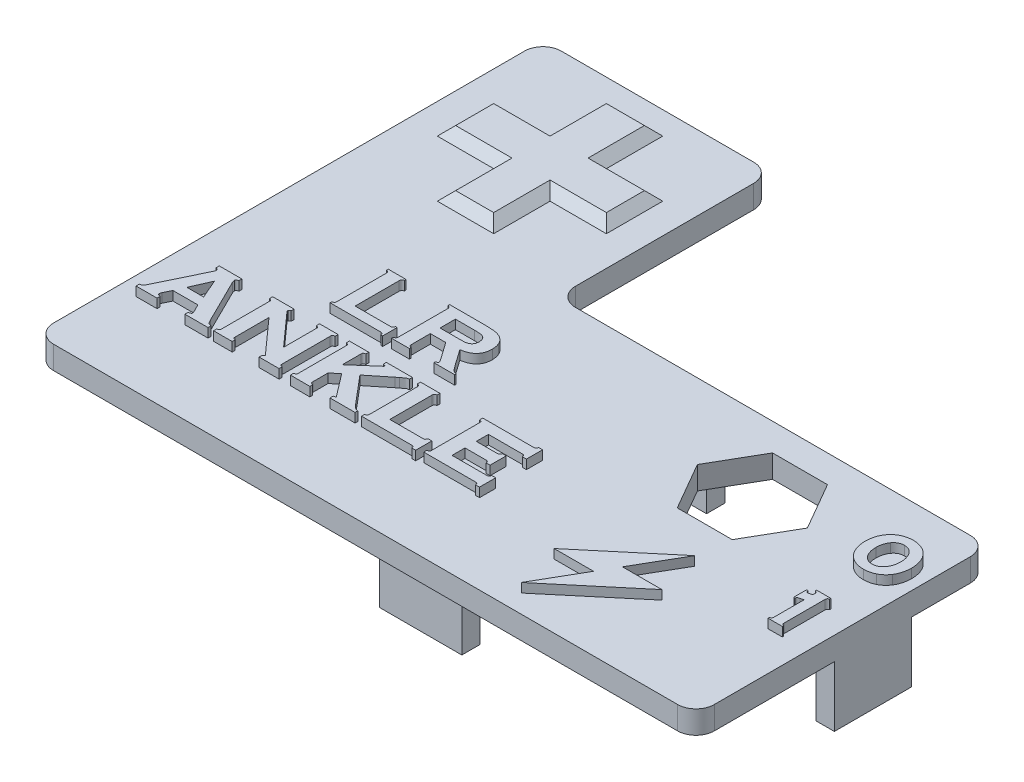
from build123d import *

# Parameters (mm, degrees)
BOSS_EXTRUDE1_DEPTH = 2.5
FILLET1_R           = 2
SKETCH2_W           = 2
SKETCH2_H           = 8.4
SKETCH2_W_2         = 9
SKETCH2_H_2         = 2
BOSS_EXTRUDE2_DEPTH = 6.6
BOSS_EXTRUDE3_DEPTH = 1
CUT_EXTRUDE1_DEPTH  = 2.5
CHAMFER1_SIZE       = 1


with BuildPart() as part:
    # Sketch1 → Boss-Extrude1 (new body)
    with BuildSketch(Plane(origin=(0, 0, 0), x_dir=(1, 0, 0), z_dir=(0, 1, 0))):
        Polygon((-36.05, 15.975), (-36.05, 39.425), (-11.05, 39.425), (-11.05, 15.975), (36.05, 15.975), (36.05, -15.975), (-36.05, -15.975), align=None)
    extrude(amount=BOSS_EXTRUDE1_DEPTH)

    # Fillet1
    fillet1_edges = [part.edges().sort_by_distance(p)[0] for p in [
        (36.05, 1.25, 15.975),
        (-36.05, 1.25, 15.975),
        (-36.05, 1.25, -39.425),
        (-11.05, 1.25, -39.425),
        (-11.05, 1.25, -15.975),
        (36.05, 1.25, -15.975),
    ]]
    fillet(fillet1_edges, radius=FILLET1_R)

    # Sketch2 → Boss-Extrude2 (add)
    with BuildSketch(Plane.XZ):
        with Locations((35.05, -3.325)):
            Rectangle(SKETCH2_W, SKETCH2_H)
        with Locations((4, -13.725)):
            Rectangle(SKETCH2_W_2, SKETCH2_H_2)
        with Locations((4, 12.975)):
            Rectangle(SKETCH2_W_2, SKETCH2_H_2)
    extrude(amount=BOSS_EXTRUDE2_DEPTH)

    # Sketch3 → Boss-Extrude3 (add)
    # profile 1 of 11: a face of its own
    with BuildSketch(Plane(origin=(0, 2.5, 0), x_dir=(1, 0, 0), z_dir=(0, 1, 0))):
        Polygon((21.914101615, -1.975), (19.027350269, -6.975), (23.328173533, -6.975), (14.985898385, -13.975), (17.872649731, -8.975), (13.571826467, -8.975), align=None)
    # profile 2 of 11: a face of its own
    with BuildSketch(Plane(origin=(0, 2.5, 0), x_dir=(1, 0, 0), z_dir=(0, 1, 0))):
        Polygon((-26.625, 36.925), (-20.475, 36.925), (-20.475, 30.775), (-14.325, 30.775), (-14.325, 24.625), (-20.475, 24.625), (-20.475, 18.475), (-26.625, 18.475), (-26.625, 24.625), (-32.775, 24.625), (-32.775, 30.775), (-26.625, 30.775), align=None)
    # profile 3 of 11: a face of its own
    with BuildSketch(Plane(origin=(0, 2.5, 0), x_dir=(1, 0, 0), z_dir=(0, 1, 0))):
        with BuildLine():
            Line((-28.887868924, -5.3875), (-31.609494358, -5.3875))
            Line((-31.609494358, -5.3875), (-32.007747396, -6.19640842))
            add(Edge.make_bspline(
                [(-32.007747396, -6.19640842), (-32.026988212, -6.238415936), (-32.062218579, -6.315332641), (-32.070248702, -6.39940725), (-32.073893229, -6.437565104)],
                knots=[0, 0, 0, 0, 1.092285905, 2, 2, 2, 2], degree=3))
            add(Edge.make_bspline(
                [(-32.073893229, -6.437565104), (-32.069750549, -6.461297047), (-32.060606622, -6.513679362), (-31.987706651, -6.572723084), (-31.887079831, -6.623630019), (-31.804132459, -6.645569845), (-31.756944444, -6.658051215)],
                knots=[0, 0, 0, 0, 0.683587642, 1.508848355, 2.58280622, 4, 4, 4, 4], degree=3))
            Line((-31.756944444, -6.658051215), (-31.756944444, -6.975))
            Line((-31.756944444, -6.975), (-34.05, -6.975))
            Line((-34.05, -6.975), (-34.05, -6.638758681))
            add(Edge.make_bspline(
                [(-34.05, -6.638758681), (-34.014901344, -6.631175306), (-33.949959524, -6.617144052), (-33.863351436, -6.58818868), (-33.793233504, -6.557797954), (-33.738628103, -6.516794774), (-33.692150597, -6.462690231), (-33.645903188, -6.390462401), (-33.5939489, -6.299111021), (-33.560783594, -6.229726186), (-33.542881944, -6.192274306)],
                knots=[0, 0, 0, 0, 1.200503865, 2.221250461, 3.05326795, 3.744957411, 4.485316885, 5.427465128, 6.611421828, 8, 8, 8, 8], degree=3))
            Line((-33.542881944, -6.192274306), (-31.244314236, -1.427018229))
            add(Edge.make_bspline(
                [(-31.244314236, -1.427018229), (-31.229133965, -1.394149346), (-31.200851032, -1.332910094), (-31.168619849, -1.245151715), (-31.149472106, -1.16873406), (-31.14550383, -1.121628495), (-31.143717448, -1.100423177)],
                knots=[0, 0, 0, 0, 1.262751781, 2.352680269, 3.258432874, 4, 4, 4, 4], degree=3))
            add(Edge.make_bspline(
                [(-31.143717448, -1.100423177), (-31.147149895, -1.076556341), (-31.154429213, -1.02594106), (-31.213053078, -0.962111092), (-31.296694535, -0.904783008), (-31.367407742, -0.879119553), (-31.406922743, -0.864778646)],
                knots=[0, 0, 0, 0, 0.756466092, 1.604265636, 2.661247999, 4, 4, 4, 4], degree=3))
            Line((-31.406922743, -0.864778646), (-31.406922743, -0.536805556))
            Line((-31.406922743, -0.536805556), (-28.937478299, -0.536805556))
            Line((-28.937478299, -0.536805556), (-28.937478299, -0.849620226))
            add(Edge.make_bspline(
                [(-28.937478299, -0.849620226), (-28.977753414, -0.862246921), (-29.04946042, -0.884727861), (-29.135969299, -0.935554829), (-29.197388427, -0.995538327), (-29.204298248, -1.045190935), (-29.207573785, -1.068728299)],
                knots=[0, 0, 0, 0, 1.358435652, 2.41859894, 3.25035135, 4, 4, 4, 4], degree=3))
            add(Edge.make_bspline(
                [(-29.207573785, -1.068728299), (-29.20641073, -1.092244153), (-29.203945602, -1.142086671), (-29.185686403, -1.218959979), (-29.15998342, -1.302952372), (-29.134333897, -1.358847418), (-29.120757378, -1.38843316)],
                knots=[0, 0, 0, 0, 0.845079754, 1.79117042, 2.830846991, 4, 4, 4, 4], degree=3))
            Line((-29.120757378, -1.38843316), (-26.786360677, -6.108213976))
            add(Edge.make_bspline(
                [(-26.786360677, -6.108213976), (-26.761621057, -6.158083937), (-26.716677153, -6.24868156), (-26.649233817, -6.36708325), (-26.593164942, -6.455717931), (-26.544599086, -6.522732768), (-26.481943514, -6.564589289), (-26.407048923, -6.600234161), (-26.310689309, -6.629511885), (-26.239412384, -6.644433549), (-26.200694444, -6.652539062)],
                knots=[0, 0, 0, 0, 1.572191128, 2.856163799, 3.842126326, 4.543098296, 5.165892684, 5.943351495, 6.882819452, 8, 8, 8, 8], degree=3))
            Line((-26.200694444, -6.652539062), (-26.200694444, -6.975))
            Line((-26.200694444, -6.975), (-28.714236111, -6.975))
            Line((-28.714236111, -6.975), (-28.714236111, -6.636002604))
            add(Edge.make_bspline(
                [(-28.714236111, -6.636002604), (-28.689800732, -6.63183729), (-28.643272432, -6.623905961), (-28.579191141, -6.606195814), (-28.524585473, -6.585670205), (-28.479871916, -6.56240819), (-28.444058301, -6.536197425), (-28.41826579, -6.505708511), (-28.40360988, -6.470425119), (-28.401251327, -6.445960473), (-28.400043403, -6.43343099)],
                knots=[0, 0, 0, 0, 1.46841687, 2.796066351, 3.933692653, 4.920221679, 5.775122949, 6.549019988, 7.256885662, 8, 8, 8, 8], degree=3))
            add(Edge.make_bspline(
                [(-28.400043403, -6.43343099), (-28.401504631, -6.41958108), (-28.404922257, -6.387187925), (-28.421381475, -6.333554115), (-28.448220593, -6.26839691), (-28.471358604, -6.221977603), (-28.484103733, -6.19640842)],
                knots=[0, 0, 0, 0, 0.659194425, 1.541770937, 2.645931803, 4, 4, 4, 4], degree=3))
            Line((-28.484103733, -6.19640842), (-28.887868924, -5.3875))
        make_face()
        Polygon((-29.321950955, -4.329166667), (-30.228700087, -2.238682726), (-31.146473524, -4.329166667), align=None, mode=Mode.SUBTRACT)
    # profile 4 of 11: a face of its own
    with BuildSketch(Plane(origin=(0, 2.5, 0), x_dir=(1, 0, 0), z_dir=(0, 1, 0))):
        with BuildLine():
            Line((-23.819444444, -2.697569444), (-23.819444444, -6.378309462))
            add(Edge.make_bspline(
                [(-23.819444444, -6.378309462), (-23.81874992, -6.399897216), (-23.817505954, -6.438563153), (-23.812851175, -6.491497032), (-23.802771835, -6.532130236), (-23.786380212, -6.565843949), (-23.75260927, -6.589008268), (-23.705314879, -6.613648804), (-23.636747132, -6.638793202), (-23.584313986, -6.655536385), (-23.554861111, -6.664941406)],
                knots=[0, 0, 0, 0, 1.168297272, 2.092543193, 2.863626271, 3.430493718, 4.06657787, 5.021996077, 6.327188346, 8, 8, 8, 8], degree=3))
            Line((-23.554861111, -6.664941406), (-23.554861111, -6.975))
            Line((-23.554861111, -6.975), (-25.583333333, -6.975))
            Line((-25.583333333, -6.975), (-25.583333333, -6.645648872))
            add(Edge.make_bspline(
                [(-25.583333333, -6.645648872), (-25.555278287, -6.636151539), (-25.504773644, -6.619054457), (-25.43778493, -6.594290002), (-25.389998947, -6.568424236), (-25.346617049, -6.534244531), (-25.322120961, -6.466247275), (-25.319983992, -6.41050045), (-25.31875, -6.378309462)],
                knots=[0, 0, 0, 0, 1.270903566, 2.287878308, 3.055159144, 3.600028367, 4.614137041, 6, 6, 6, 6], degree=3))
            Line((-25.31875, -6.378309462), (-25.31875, -1.127983941))
            add(Edge.make_bspline(
                [(-25.31875, -1.127983941), (-25.319913639, -1.09708089), (-25.32193507, -1.043397214), (-25.347399798, -0.97844533), (-25.389965355, -0.944749705), (-25.437798765, -0.918897567), (-25.504768663, -0.894127705), (-25.555276509, -0.877031544), (-25.583333333, -0.867534722)],
                knots=[0, 0, 0, 0, 1.348336138, 2.342281394, 2.895882114, 3.675458579, 4.708730281, 6, 6, 6, 6], degree=3))
            Line((-25.583333333, -0.867534722), (-25.583333333, -0.536805556))
            Line((-25.583333333, -0.536805556), (-23.248936632, -0.536805556))
            Line((-23.248936632, -0.536805556), (-23.248936632, -0.852376302))
            add(Edge.make_bspline(
                [(-23.248936632, -0.852376302), (-23.277276585, -0.861127625), (-23.327847224, -0.876743742), (-23.392380515, -0.90956379), (-23.433489822, -0.956210264), (-23.439170929, -0.992352602), (-23.441861979, -1.009472656)],
                knots=[0, 0, 0, 0, 1.333897094, 2.380244923, 3.232747595, 4, 4, 4, 4], degree=3))
            add(Edge.make_bspline(
                [(-23.441861979, -1.009472656), (-23.438353198, -1.042843704), (-23.431231825, -1.11057311), (-23.388000592, -1.163265439), (-23.366069878, -1.18999566)],
                knots=[0, 0, 0, 0, 0.985422698, 2, 2, 2, 2], degree=3))
            Line((-23.366069878, -1.18999566), (-20.203472222, -4.719151476))
            Line((-20.203472222, -4.719151476), (-20.203472222, -1.127983941))
            add(Edge.make_bspline(
                [(-20.203472222, -1.127983941), (-20.204635861, -1.09708089), (-20.206657292, -1.043397214), (-20.23212202, -0.97844533), (-20.274687577, -0.944749705), (-20.322520988, -0.918897567), (-20.389490885, -0.894127705), (-20.439998731, -0.877031544), (-20.468055556, -0.867534722)],
                knots=[0, 0, 0, 0, 1.348336138, 2.342281394, 2.895882114, 3.675458579, 4.708730281, 6, 6, 6, 6], degree=3))
            Line((-20.468055556, -0.867534722), (-20.468055556, -0.536805556))
            Line((-20.468055556, -0.536805556), (-18.439583333, -0.536805556))
            Line((-18.439583333, -0.536805556), (-18.439583333, -0.848242187))
            add(Edge.make_bspline(
                [(-18.439583333, -0.848242187), (-18.468603571, -0.857626663), (-18.520590241, -0.874437952), (-18.588732689, -0.900165223), (-18.637666064, -0.923510568), (-18.670768273, -0.948727557), (-18.687039353, -0.981558828), (-18.697866709, -1.020687503), (-18.702060164, -1.070960242), (-18.703420307, -1.107779735), (-18.704166667, -1.127983941)],
                knots=[0, 0, 0, 0, 1.677063113, 3.004280154, 3.998210204, 4.661097541, 5.237530725, 5.972938197, 6.887676847, 8, 8, 8, 8], degree=3))
            Line((-18.704166667, -1.127983941), (-18.704166667, -6.378309462))
            add(Edge.make_bspline(
                [(-18.704166667, -6.378309462), (-18.703472142, -6.399897216), (-18.702228176, -6.438563153), (-18.697573397, -6.491497032), (-18.687494058, -6.532130236), (-18.671102434, -6.565843949), (-18.637331492, -6.589008268), (-18.590037101, -6.613648804), (-18.521469354, -6.638793202), (-18.469036208, -6.655536385), (-18.439583333, -6.664941406)],
                knots=[0, 0, 0, 0, 1.168297272, 2.092543193, 2.863626271, 3.430493718, 4.06657787, 5.021996077, 6.327188346, 8, 8, 8, 8], degree=3))
            Line((-18.439583333, -6.664941406), (-18.439583333, -6.975))
            Line((-18.439583333, -6.975), (-20.621017795, -6.975))
            Line((-20.621017795, -6.975), (-20.621017795, -6.640136719))
            add(Edge.make_bspline(
                [(-20.621017795, -6.640136719), (-20.592952497, -6.633446707), (-20.543754498, -6.621719228), (-20.484789177, -6.592542598), (-20.440593323, -6.559640341), (-20.435804948, -6.528873277), (-20.433604601, -6.514735243)],
                knots=[0, 0, 0, 0, 1.427158009, 2.501784109, 3.311542117, 4, 4, 4, 4], degree=3))
            add(Edge.make_bspline(
                [(-20.433604601, -6.514735243), (-20.437214279, -6.502543418), (-20.446973398, -6.469581625), (-20.488103016, -6.416367421), (-20.549742152, -6.344175674), (-20.600482948, -6.290351523), (-20.629286024, -6.259798177)],
                knots=[0, 0, 0, 0, 0.467922828, 1.265075161, 2.447516532, 4, 4, 4, 4], degree=3))
            Line((-20.629286024, -6.259798177), (-23.819444444, -2.697569444))
        make_face()
    # profile 5 of 11: a face of its own
    with BuildSketch(Plane(origin=(0, 2.5, 0), x_dir=(1, 0, 0), z_dir=(0, 1, 0))):
        with BuildLine():
            Line((-14.556271701, -4.027376302), (-15.352777778, -4.731553819))
            Line((-15.352777778, -4.731553819), (-15.352777778, -6.378309462))
            add(Edge.make_bspline(
                [(-15.352777778, -6.378309462), (-15.352294698, -6.399472319), (-15.351419891, -6.437795987), (-15.344337958, -6.489945623), (-15.334897246, -6.531568086), (-15.316828072, -6.565285209), (-15.283642964, -6.59109629), (-15.235136496, -6.614285804), (-15.167755067, -6.638583322), (-15.116742415, -6.654600019), (-15.088194444, -6.663563368)],
                knots=[0, 0, 0, 0, 1.148820936, 2.080391588, 2.85507263, 3.458551883, 4.113480583, 5.09547749, 6.374555674, 8, 8, 8, 8], degree=3))
            Line((-15.088194444, -6.663563368), (-15.088194444, -6.975))
            Line((-15.088194444, -6.975), (-17.204861111, -6.975))
            Line((-17.204861111, -6.975), (-17.204861111, -6.645648872))
            add(Edge.make_bspline(
                [(-17.204861111, -6.645648872), (-17.176806065, -6.636151539), (-17.126301421, -6.619054457), (-17.059312708, -6.594290002), (-17.011526725, -6.568424236), (-16.968144827, -6.534244531), (-16.943648739, -6.466247275), (-16.94151177, -6.41050045), (-16.940277778, -6.378309462)],
                knots=[0, 0, 0, 0, 1.270903566, 2.287878308, 3.055159144, 3.600028367, 4.614137041, 6, 6, 6, 6], degree=3))
            Line((-16.940277778, -6.378309462), (-16.940277778, -1.127983941))
            add(Edge.make_bspline(
                [(-16.940277778, -1.127983941), (-16.941441416, -1.09708089), (-16.943462848, -1.043397214), (-16.968927576, -0.97844533), (-17.011493132, -0.944749705), (-17.059326543, -0.918897567), (-17.126296441, -0.894127705), (-17.176804286, -0.877031544), (-17.204861111, -0.867534722)],
                knots=[0, 0, 0, 0, 1.348336138, 2.342281394, 2.895882114, 3.675458579, 4.708730281, 6, 6, 6, 6], degree=3))
            Line((-17.204861111, -0.867534722), (-17.204861111, -0.536805556))
            Line((-17.204861111, -0.536805556), (-15.088194444, -0.536805556))
            Line((-15.088194444, -0.536805556), (-15.088194444, -0.850998264))
            add(Edge.make_bspline(
                [(-15.088194444, -0.850998264), (-15.117284725, -0.859263131), (-15.169037966, -0.873966793), (-15.236076366, -0.899411349), (-15.285198453, -0.92063671), (-15.317957012, -0.946020118), (-15.334356557, -0.978778043), (-15.344578685, -1.017604085), (-15.351243332, -1.066223073), (-15.35223764, -1.101778809), (-15.352777778, -1.12109375)],
                knots=[0, 0, 0, 0, 1.689553727, 3.005810864, 4.004869542, 4.678835048, 5.264901578, 6.012599175, 6.920384306, 8, 8, 8, 8], degree=3))
            Line((-15.352777778, -1.12109375), (-15.352777778, -3.15921224))
            Line((-15.352777778, -3.15921224), (-13.055588108, -1.147276476))
            add(Edge.make_bspline(
                [(-13.055588108, -1.147276476), (-13.033740425, -1.129143656), (-12.995119847, -1.097089912), (-12.947773384, -1.052208786), (-12.916983038, -1.016007235), (-12.909553614, -0.992230514), (-12.906759983, -0.983289931)],
                knots=[0, 0, 0, 0, 1.515017203, 2.678125759, 3.502945504, 4, 4, 4, 4], degree=3))
            add(Edge.make_bspline(
                [(-12.906759983, -0.983289931), (-12.911472655, -0.972871707), (-12.924209537, -0.944714503), (-12.984178706, -0.922434641), (-13.065743577, -0.894133596), (-13.134536877, -0.881620882), (-13.174099392, -0.874424913)],
                knots=[0, 0, 0, 0, 0.446973481, 1.208029717, 2.394358675, 4, 4, 4, 4], degree=3))
            Line((-13.174099392, -0.874424913), (-13.174099392, -0.536805556))
            Line((-13.174099392, -0.536805556), (-10.325694444, -0.536805556))
            Line((-10.325694444, -0.536805556), (-10.325694444, -0.859266493))
            add(Edge.make_bspline(
                [(-10.325694444, -0.859266493), (-10.362887585, -0.867039679), (-10.428205845, -0.880690878), (-10.514311055, -0.899085661), (-10.573154464, -0.916834955), (-10.611015306, -0.929405829), (-10.633232593, -0.94737057), (-10.659230067, -0.965117026), (-10.694171619, -0.992852381), (-10.739738786, -1.028538429), (-10.794825843, -1.072692799), (-10.859704008, -1.125487776), (-10.935432465, -1.185630628), (-10.98902703, -1.228994311), (-11.017469618, -1.252007378)],
                knots=[0, 0, 0, 0, 1.684495241, 2.95829537, 3.892088238, 4.42126145, 4.698089674, 5.149995523, 5.817617521, 6.672678047, 7.715250913, 8.945376179, 10.378913871, 12, 12, 12, 12], degree=3))
            Line((-11.017469618, -1.252007378), (-11.302723524, -1.46422526))
            Line((-11.302723524, -1.46422526), (-13.420768229, -3.172992622))
            Line((-13.420768229, -3.172992622), (-11.047786458, -5.986946615))
            add(Edge.make_bspline(
                [(-11.047786458, -5.986946615), (-11.019321086, -6.021868095), (-10.965289867, -6.088153903), (-10.888188133, -6.182305046), (-10.817950173, -6.265043392), (-10.754396908, -6.337048307), (-10.697652943, -6.398402958), (-10.650620892, -6.451477179), (-10.608387901, -6.491542629), (-10.561531984, -6.53433952), (-10.494583075, -6.575932546), (-10.398531494, -6.615313875), (-10.28161712, -6.649291216), (-10.195426483, -6.664872196), (-10.149305556, -6.673209635)],
                knots=[0, 0, 0, 0, 1.3856826, 2.630217524, 3.742735644, 4.723579208, 5.583639575, 6.31351798, 6.903006854, 7.373487758, 8.263094004, 9.3075047, 10.559235838, 12, 12, 12, 12], degree=3))
            Line((-10.149305556, -6.673209635), (-10.149305556, -6.975))
            Line((-10.149305556, -6.975), (-12.888845486, -6.975))
            Line((-12.888845486, -6.975), (-12.888845486, -6.638758681))
            add(Edge.make_bspline(
                [(-12.888845486, -6.638758681), (-12.852634475, -6.631181887), (-12.789815144, -6.618037568), (-12.713793682, -6.593213057), (-12.659250891, -6.572288109), (-12.646615732, -6.547034268), (-12.642176649, -6.538161892)],
                knots=[0, 0, 0, 0, 1.609728793, 2.792578347, 3.575799217, 4, 4, 4, 4], degree=3))
            add(Edge.make_bspline(
                [(-12.642176649, -6.538161892), (-12.6460239, -6.528360921), (-12.658231487, -6.49726178), (-12.701274723, -6.442765021), (-12.764868287, -6.358573837), (-12.817361435, -6.294077528), (-12.84750434, -6.257042101)],
                knots=[0, 0, 0, 0, 0.360711672, 1.144562472, 2.360334903, 4, 4, 4, 4], degree=3))
            Line((-12.84750434, -6.257042101), (-14.556271701, -4.027376302))
        make_face()
    # profile 6 of 11: a face of its own
    with BuildSketch(Plane(origin=(0, 2.5, 0), x_dir=(1, 0, 0), z_dir=(0, 1, 0))):
        with BuildLine():
            Line((-7.591666667, -5.740277778), (-3.955023872, -5.740277778))
            add(Edge.make_bspline(
                [(-3.955023872, -5.740277778), (-3.923196297, -5.739194859), (-3.8675538, -5.737301649), (-3.800712629, -5.710963009), (-3.766204678, -5.66773318), (-3.740695581, -5.619549405), (-3.713832577, -5.553868246), (-3.697839392, -5.503394118), (-3.6890625, -5.475694444)],
                knots=[0, 0, 0, 0, 1.37289143, 2.400154871, 2.947667793, 3.718671465, 4.748030781, 6, 6, 6, 6], degree=3))
            Line((-3.6890625, -5.475694444), (-3.270138889, -5.475694444))
            Line((-3.270138889, -5.475694444), (-3.270138889, -7.239583333))
            Line((-3.270138889, -7.239583333), (-3.6890625, -7.239583333))
            add(Edge.make_bspline(
                [(-3.6890625, -7.239583333), (-3.698477309, -7.211491916), (-3.715290333, -7.161326086), (-3.740750423, -7.095113519), (-3.766234907, -7.04754136), (-3.800452979, -7.004699227), (-3.865567596, -6.977983941), (-3.919941481, -6.976082343), (-3.950889757, -6.975)],
                knots=[0, 0, 0, 0, 1.289536581, 2.302862591, 3.081392711, 3.63425039, 4.653473594, 6, 6, 6, 6], degree=3))
            Line((-3.950889757, -6.975), (-9.44375, -6.975))
            Line((-9.44375, -6.975), (-9.44375, -6.645648872))
            add(Edge.make_bspline(
                [(-9.44375, -6.645648872), (-9.415694954, -6.636151539), (-9.36519031, -6.619054457), (-9.298201597, -6.594290002), (-9.250415614, -6.568424236), (-9.207033716, -6.534244531), (-9.182537628, -6.466247275), (-9.180400659, -6.41050045), (-9.179166667, -6.378309462)],
                knots=[0, 0, 0, 0, 1.270903566, 2.287878308, 3.055159144, 3.600028367, 4.614137041, 6, 6, 6, 6], degree=3))
            Line((-9.179166667, -6.378309462), (-9.179166667, -1.133496094))
            add(Edge.make_bspline(
                [(-9.179166667, -1.133496094), (-9.180282314, -1.101255409), (-9.182199886, -1.045840197), (-9.20742284, -0.978690716), (-9.250399822, -0.944754866), (-9.298208101, -0.918895441), (-9.365187969, -0.894128471), (-9.415694118, -0.877031817), (-9.44375, -0.867534722)],
                knots=[0, 0, 0, 0, 1.390022291, 2.38916702, 2.935671537, 3.705255179, 4.725282125, 6, 6, 6, 6], degree=3))
            Line((-9.44375, -0.867534722), (-9.44375, -0.536805556))
            Line((-9.44375, -0.536805556), (-7.327083333, -0.536805556))
            Line((-7.327083333, -0.536805556), (-7.327083333, -0.850998264))
            add(Edge.make_bspline(
                [(-7.327083333, -0.850998264), (-7.35620903, -0.859139979), (-7.40818445, -0.873669042), (-7.475196328, -0.900540733), (-7.523727106, -0.923517155), (-7.557383821, -0.948897803), (-7.572825581, -0.982691482), (-7.583887338, -1.022546014), (-7.590061106, -1.073619752), (-7.591099106, -1.111439075), (-7.591666667, -1.132118056)],
                knots=[0, 0, 0, 0, 1.654165102, 2.951892616, 3.941266893, 4.601115824, 5.197056547, 5.929093209, 6.867662398, 8, 8, 8, 8], degree=3))
            Line((-7.591666667, -1.132118056), (-7.591666667, -5.740277778))
        make_face()
    # profile 7 of 11: a face of its own
    with BuildSketch(Plane(origin=(0, 2.5, 0), x_dir=(1, 0, 0), z_dir=(0, 1, 0))):
        with BuildLine():
            Line((-0.800694444, -4.329166667), (-0.800694444, -5.740277778))
            Line((-0.800694444, -5.740277778), (3.016471354, -5.740277778))
            add(Edge.make_bspline(
                [(3.016471354, -5.740277778), (3.047422122, -5.739196439), (3.101800384, -5.737296604), (3.166891936, -5.710572029), (3.201162155, -5.667750897), (3.226663153, -5.619542044), (3.253529365, -5.553870821), (3.269522013, -5.50339503), (3.278298611, -5.475694444)],
                knots=[0, 0, 0, 0, 1.34636125, 2.365459444, 2.918249314, 3.696683944, 4.73596426, 6, 6, 6, 6], degree=3))
            Line((3.278298611, -5.475694444), (3.697222222, -5.475694444))
            Line((3.697222222, -5.475694444), (3.697222222, -7.239583333))
            Line((3.697222222, -7.239583333), (3.278298611, -7.239583333))
            add(Edge.make_bspline(
                [(3.278298611, -7.239583333), (3.26881837, -7.211528728), (3.251888496, -7.161428635), (3.227029737, -7.094617869), (3.19964743, -7.047847345), (3.165880196, -7.005029981), (3.10280327, -6.978204932), (3.050194149, -6.976153677), (3.020605469, -6.975)],
                knots=[0, 0, 0, 0, 1.304247938, 2.329134225, 3.126603422, 3.68576824, 4.698418437, 6, 6, 6, 6], degree=3))
            Line((3.020605469, -6.975), (-2.652777778, -6.975))
            Line((-2.652777778, -6.975), (-2.652777778, -6.645648872))
            add(Edge.make_bspline(
                [(-2.652777778, -6.645648872), (-2.624722732, -6.636151539), (-2.574218088, -6.619054457), (-2.507229375, -6.594290002), (-2.459443391, -6.568424236), (-2.416061494, -6.534244531), (-2.391565406, -6.466247275), (-2.389428437, -6.41050045), (-2.388194444, -6.378309462)],
                knots=[0, 0, 0, 0, 1.270903566, 2.287878308, 3.055159144, 3.600028367, 4.614137041, 6, 6, 6, 6], degree=3))
            Line((-2.388194444, -6.378309462), (-2.388194444, -1.133496094))
            add(Edge.make_bspline(
                [(-2.388194444, -1.133496094), (-2.389310092, -1.101255409), (-2.391227664, -1.045840197), (-2.416450618, -0.978690716), (-2.4594276, -0.944754866), (-2.507235878, -0.918895441), (-2.574215747, -0.894128471), (-2.624721895, -0.877031817), (-2.652777778, -0.867534722)],
                knots=[0, 0, 0, 0, 1.390022291, 2.38916702, 2.935671537, 3.705255179, 4.725282125, 6, 6, 6, 6], degree=3))
            Line((-2.652777778, -0.867534722), (-2.652777778, -0.536805556))
            Line((-2.652777778, -0.536805556), (2.931032986, -0.536805556))
            add(Edge.make_bspline(
                [(2.931032986, -0.536805556), (2.961085458, -0.53571096), (3.014163652, -0.533777704), (3.077694466, -0.50678001), (3.111433219, -0.46395028), (3.139178521, -0.416868232), (3.163095629, -0.349691075), (3.180499731, -0.299770719), (3.190104167, -0.272222222)],
                knots=[0, 0, 0, 0, 1.317339458, 2.326663858, 2.883992238, 3.678842347, 4.719071565, 6, 6, 6, 6], degree=3))
            Line((3.190104167, -0.272222222), (3.609027778, -0.272222222))
            Line((3.609027778, -0.272222222), (3.609027778, -2.036111111))
            Line((3.609027778, -2.036111111), (3.190104167, -2.036111111))
            add(Edge.make_bspline(
                [(3.190104167, -2.036111111), (3.181428424, -2.00835834), (3.16574598, -1.958191877), (3.13800279, -1.893457716), (3.113213919, -1.844806679), (3.076562329, -1.802911028), (3.012255323, -1.774295539), (2.957510193, -1.772520378), (2.926898872, -1.771527778)],
                knots=[0, 0, 0, 0, 1.263696698, 2.284283375, 3.062509213, 3.628357544, 4.673870881, 6, 6, 6, 6], degree=3))
            Line((2.926898872, -1.771527778), (-0.800694444, -1.771527778))
            Line((-0.800694444, -1.771527778), (-0.800694444, -3.094444444))
            Line((-0.800694444, -3.094444444), (1.519921875, -3.094444444))
            add(Edge.make_bspline(
                [(1.519921875, -3.094444444), (1.550835007, -3.093286079), (1.604536195, -3.091273808), (1.669396894, -3.065761382), (1.703557034, -3.022985336), (1.728194554, -2.974541889), (1.754455785, -2.908395749), (1.770197407, -2.858012697), (1.778993056, -2.829861111)],
                knots=[0, 0, 0, 0, 1.350007337, 2.345184541, 2.899471423, 3.697568048, 4.713513627, 6, 6, 6, 6], degree=3))
            Line((1.778993056, -2.829861111), (2.197916667, -2.829861111))
            Line((2.197916667, -2.829861111), (2.197916667, -4.59375))
            Line((2.197916667, -4.59375), (1.778993056, -4.59375))
            add(Edge.make_bspline(
                [(1.778993056, -4.59375), (1.769423972, -4.566642156), (1.752108787, -4.517590719), (1.727744258, -4.451549956), (1.700368081, -4.404719593), (1.666342048, -4.361965651), (1.603439721, -4.333328245), (1.55005454, -4.330668136), (1.519921875, -4.329166667)],
                knots=[0, 0, 0, 0, 1.26750182, 2.293534889, 3.091896403, 3.651686891, 4.674521096, 6, 6, 6, 6], degree=3))
            Line((1.519921875, -4.329166667), (-0.800694444, -4.329166667))
        make_face()
    # profile 8 of 11: a face of its own
    with BuildSketch(Plane(origin=(0, 2.5, 0), x_dir=(1, 0, 0), z_dir=(0, 1, 0))):
        with BuildLine():
            Line((-20.194791667, 3.083333333), (-16.381759983, 3.083333333))
            add(Edge.make_bspline(
                [(-16.381759983, 3.083333333), (-16.359669473, 3.08415726), (-16.317940569, 3.085713654), (-16.259695093, 3.096279186), (-16.209945218, 3.114668035), (-16.166613255, 3.139486458), (-16.130762423, 3.176744953), (-16.099829999, 3.223685494), (-16.071795056, 3.281692258), (-16.057399092, 3.324748542), (-16.049652778, 3.347916667)],
                knots=[0, 0, 0, 0, 1.13718709, 2.148142964, 3.030969728, 3.85821599, 4.694202194, 5.66481062, 6.743459618, 8, 8, 8, 8], degree=3))
            Line((-16.049652778, 3.347916667), (-15.873263889, 3.347916667))
            Line((-15.873263889, 3.347916667), (-15.873263889, 1.760416667))
            Line((-15.873263889, 1.760416667), (-16.049652778, 1.760416667))
            add(Edge.make_bspline(
                [(-16.049652778, 1.760416667), (-16.05751257, 1.783522919), (-16.072252661, 1.826855906), (-16.098990934, 1.885620961), (-16.131257353, 1.931681921), (-16.166513714, 1.969016056), (-16.210280722, 1.993225085), (-16.259600252, 2.014506541), (-16.319116666, 2.021822153), (-16.361106198, 2.0239064), (-16.383138021, 2.025)],
                knots=[0, 0, 0, 0, 1.251925329, 2.347834872, 3.295457317, 4.12837309, 4.952581021, 5.840642677, 6.866989599, 8, 8, 8, 8], degree=3))
            Line((-16.383138021, 2.025), (-21.870486111, 2.025))
            Line((-21.870486111, 2.025), (-21.870486111, 2.201388889))
            add(Edge.make_bspline(
                [(-21.870486111, 2.201388889), (-21.84737908, 2.209248385), (-21.804044632, 2.223987922), (-21.745289064, 2.250729794), (-21.699198827, 2.282985108), (-21.661957986, 2.318276858), (-21.636981363, 2.362666226), (-21.617173449, 2.412988597), (-21.608749169, 2.473072668), (-21.606895471, 2.51511544), (-21.605902778, 2.537630208)],
                knots=[0, 0, 0, 0, 1.245049627, 2.334940322, 3.277358327, 4.105699642, 4.925380938, 5.852235277, 6.849827876, 8, 8, 8, 8], degree=3))
            Line((-21.605902778, 2.537630208), (-21.605902778, 7.862369792))
            add(Edge.make_bspline(
                [(-21.605902778, 7.862369792), (-21.606915907, 7.884878495), (-21.608807765, 7.926909942), (-21.616922496, 7.986640616), (-21.637244869, 8.03635842), (-21.66234903, 8.080392165), (-21.698667664, 8.117087354), (-21.745374463, 8.14918498), (-21.804018234, 8.176038422), (-21.847369899, 8.190760777), (-21.870486111, 8.198611111)],
                knots=[0, 0, 0, 0, 1.150912396, 2.149147064, 3.054708998, 3.874917856, 4.720532304, 5.663556867, 6.754149036, 8, 8, 8, 8], degree=3))
            Line((-21.870486111, 8.198611111), (-21.870486111, 8.375))
            Line((-21.870486111, 8.375), (-19.930208333, 8.375))
            Line((-19.930208333, 8.375), (-19.930208333, 8.198611111))
            add(Edge.make_bspline(
                [(-19.930208333, 8.198611111), (-19.95332054, 8.191247244), (-19.996209045, 8.177582375), (-20.05517834, 8.151564947), (-20.101451545, 8.118754642), (-20.138718662, 8.081592477), (-20.163451889, 8.03687586), (-20.181829327, 7.98577935), (-20.19240531, 7.926178987), (-20.193966206, 7.883540547), (-20.194791667, 7.860991753)],
                knots=[0, 0, 0, 0, 1.233044476, 2.288117098, 3.259808654, 4.10196579, 4.938928384, 5.832590396, 6.853793133, 8, 8, 8, 8], degree=3))
            Line((-20.194791667, 7.860991753), (-20.194791667, 3.083333333))
        make_face()
    # profile 9 of 11: a face of its own
    with BuildSketch(Plane(origin=(0, 2.5, 0), x_dir=(1, 0, 0), z_dir=(0, 1, 0))):
        with BuildLine():
            Line((-13.492013889, 4.582638889), (-13.492013889, 2.527983941))
            add(Edge.make_bspline(
                [(-13.492013889, 2.527983941), (-13.491216918, 2.506342162), (-13.489713044, 2.46550442), (-13.47876255, 2.408306229), (-13.460907961, 2.358547365), (-13.434365104, 2.315422257), (-13.396056206, 2.280677062), (-13.350508551, 2.248088055), (-13.292402129, 2.222700887), (-13.250058737, 2.208811393), (-13.227430556, 2.201388889)],
                knots=[0, 0, 0, 0, 1.124460146, 2.121840966, 3.013286232, 3.861139776, 4.722335659, 5.682736552, 6.761661326, 8, 8, 8, 8], degree=3))
            Line((-13.227430556, 2.201388889), (-13.227430556, 2.025))
            Line((-13.227430556, 2.025), (-15.167708333, 2.025))
            Line((-15.167708333, 2.025), (-15.167708333, 2.201388889))
            add(Edge.make_bspline(
                [(-15.167708333, 2.201388889), (-15.144601639, 2.209248522), (-15.101267823, 2.223988314), (-15.042508153, 2.250728526), (-14.996430573, 2.282988964), (-14.959149401, 2.318264384), (-14.934534954, 2.362337372), (-14.914335353, 2.411541713), (-14.905979199, 2.470319155), (-14.904121286, 2.511443566), (-14.903125, 2.533496094)],
                knots=[0, 0, 0, 0, 1.255780561, 2.355064893, 3.305605487, 4.141086176, 4.967832208, 5.880611589, 6.863500559, 8, 8, 8, 8], degree=3))
            Line((-14.903125, 2.533496094), (-14.903125, 7.862369792))
            add(Edge.make_bspline(
                [(-14.903125, 7.862369792), (-14.904138129, 7.884878495), (-14.906029987, 7.926909942), (-14.914144718, 7.986640616), (-14.934467091, 8.03635842), (-14.959571252, 8.080392165), (-14.995889886, 8.117087354), (-15.042596685, 8.14918498), (-15.101240456, 8.176038422), (-15.144592122, 8.190760777), (-15.167708333, 8.198611111)],
                knots=[0, 0, 0, 0, 1.150912396, 2.149147064, 3.054708998, 3.874917856, 4.720532304, 5.663556867, 6.754149036, 8, 8, 8, 8], degree=3))
            Line((-15.167708333, 8.198611111), (-15.167708333, 8.375))
            Line((-15.167708333, 8.375), (-11.23203125, 8.375))
            add(Edge.make_bspline(
                [(-11.23203125, 8.375), (-11.118095899, 8.37394185), (-10.902975765, 8.371943968), (-10.598579471, 8.357312062), (-10.331644526, 8.332343595), (-10.097596914, 8.295250246), (-9.888734521, 8.244849599), (-9.69674322, 8.180844138), (-9.518372225, 8.099345565), (-9.409176957, 8.032080657), (-9.355143229, 7.998795573)],
                knots=[0, 0, 0, 0, 1.407806318, 2.658064248, 3.764457201, 4.719038315, 5.583565669, 6.416396437, 7.216376255, 8, 8, 8, 8], degree=3))
            add(Edge.make_bspline(
                [(-9.355143229, 7.998795573), (-9.29674757, 7.956392494), (-9.180940499, 7.87230103), (-9.032606466, 7.71612757), (-8.906249233, 7.540142276), (-8.843811781, 7.409168697), (-8.812196181, 7.342849392)],
                knots=[0, 0, 0, 0, 1.001529461, 1.98617835, 2.980288594, 4, 4, 4, 4], degree=3))
            add(Edge.make_bspline(
                [(-8.812196181, 7.342849392), (-8.785914331, 7.275815443), (-8.733134514, 7.141196319), (-8.680614378, 6.929738528), (-8.647694021, 6.711370865), (-8.643464105, 6.56345986), (-8.641319444, 6.488465712)],
                knots=[0, 0, 0, 0, 0.984363557, 1.976821606, 2.974203853, 4, 4, 4, 4], degree=3))
            add(Edge.make_bspline(
                [(-8.641319444, 6.488465712), (-8.64253718, 6.425468581), (-8.644917323, 6.30233657), (-8.666560604, 6.122739113), (-8.698593487, 5.952792968), (-8.745798949, 5.793110306), (-8.806476043, 5.643404224), (-8.881036513, 5.504028837), (-8.968516489, 5.374484989), (-9.06980986, 5.255361151), (-9.184938402, 5.146048408), (-9.313310168, 5.046826682), (-9.45552805, 4.957903244), (-9.611089861, 4.879762369), (-9.780130717, 4.812578125), (-9.961946861, 4.754422431), (-10.157230339, 4.706366704), (-10.292964279, 4.682869129), (-10.362489149, 4.670833333)],
                knots=[0, 0, 0, 0, 1.087205603, 2.125014432, 3.118864887, 4.069900136, 4.994750613, 5.903029732, 6.793864856, 7.688469125, 8.597198221, 9.529937486, 10.484899445, 11.48860474, 12.531250455, 13.622238558, 14.782076498, 16, 16, 16, 16], degree=3))
            Line((-10.362489149, 4.670833333), (-9.13327908, 2.922102865))
            add(Edge.make_bspline(
                [(-9.13327908, 2.922102865), (-9.107268167, 2.886145476), (-9.057617445, 2.817508502), (-8.983565641, 2.720887609), (-8.917170651, 2.632716915), (-8.854451564, 2.55564735), (-8.798956779, 2.487243577), (-8.745489497, 2.431612981), (-8.701126792, 2.38276051), (-8.647949288, 2.332722911), (-8.579212712, 2.284471045), (-8.489849566, 2.241488762), (-8.392280312, 2.211400292), (-8.32366695, 2.20477869), (-8.288541667, 2.201388889)],
                knots=[0, 0, 0, 0, 1.386295437, 2.646218958, 3.802867978, 4.833757417, 5.750572313, 6.55274925, 7.24303171, 7.811616172, 8.830854499, 9.851304282, 10.900016794, 12, 12, 12, 12], degree=3))
            Line((-8.288541667, 2.201388889), (-8.288541667, 2.025))
            Line((-8.288541667, 2.025), (-10.547146267, 2.025))
            Line((-10.547146267, 2.025), (-10.547146267, 2.201388889))
            add(Edge.make_bspline(
                [(-10.547146267, 2.201388889), (-10.512758848, 2.207777469), (-10.451227789, 2.219208862), (-10.373947948, 2.252774233), (-10.32248814, 2.303691423), (-10.316020016, 2.345215635), (-10.312879774, 2.365375434)],
                knots=[0, 0, 0, 0, 1.348096298, 2.412213403, 3.229137467, 4, 4, 4, 4], degree=3))
            add(Edge.make_bspline(
                [(-10.312879774, 2.365375434), (-10.316817386, 2.383973855), (-10.327205389, 2.433039244), (-10.372435771, 2.516386788), (-10.439780643, 2.629030496), (-10.496103889, 2.712462884), (-10.527853733, 2.759494358)],
                knots=[0, 0, 0, 0, 0.503246529, 1.327638908, 2.493569678, 4, 4, 4, 4], degree=3))
            Line((-10.527853733, 2.759494358), (-11.809429253, 4.582638889))
            Line((-11.809429253, 4.582638889), (-13.492013889, 4.582638889))
        make_face()
        with BuildLine():
            Line((-13.492013889, 5.640972222), (-11.401529948, 5.640972222))
            add(Edge.make_bspline(
                [(-11.401529948, 5.640972222), (-11.329864112, 5.641020135), (-11.197990538, 5.6411083), (-11.017453235, 5.646954184), (-10.871155246, 5.654061555), (-10.722926733, 5.669502142), (-10.564593315, 5.705319718), (-10.453093979, 5.759197774), (-10.398318142, 5.785666233)],
                knots=[0, 0, 0, 0, 1.258722572, 2.316197689, 3.172835006, 3.830410977, 4.934154601, 6, 6, 6, 6], degree=3))
            add(Edge.make_bspline(
                [(-10.398318142, 5.785666233), (-10.370538684, 5.802188792), (-10.315572706, 5.834881244), (-10.245730587, 5.899736163), (-10.184505795, 5.972121386), (-10.137324718, 6.055966776), (-10.097326656, 6.147392887), (-10.072372055, 6.249944806), (-10.055227272, 6.361104749), (-10.053381754, 6.438783196), (-10.052430556, 6.478819444)],
                knots=[0, 0, 0, 0, 0.948518217, 1.876790744, 2.788783491, 3.727622698, 4.696623459, 5.716150367, 6.822881049, 8, 8, 8, 8], degree=3))
            add(Edge.make_bspline(
                [(-10.052430556, 6.478819444), (-10.053381754, 6.518855693), (-10.055227272, 6.59653414), (-10.072372055, 6.707694083), (-10.097326656, 6.810246002), (-10.137324718, 6.901672113), (-10.184505795, 6.985517503), (-10.245730587, 7.057902725), (-10.315572706, 7.122757645), (-10.370538684, 7.155450097), (-10.398318142, 7.171972656)],
                knots=[0, 0, 0, 0, 1.177118951, 2.283849633, 3.303376541, 4.272377302, 5.211216509, 6.123209256, 7.051481783, 8, 8, 8, 8], degree=3))
            add(Edge.make_bspline(
                [(-10.398318142, 7.171972656), (-10.453364311, 7.20029216), (-10.563119596, 7.256757767), (-10.721260405, 7.289920873), (-10.867092589, 7.303115677), (-11.013305607, 7.31096529), (-11.195239263, 7.316444659), (-11.328946971, 7.316588554), (-11.401529948, 7.316666667)],
                knots=[0, 0, 0, 0, 1.0821492, 2.15767232, 2.805799782, 3.653626201, 4.726275406, 6, 6, 6, 6], degree=3))
            Line((-11.401529948, 7.316666667), (-13.492013889, 7.316666667))
            Line((-13.492013889, 7.316666667), (-13.492013889, 5.640972222))
        make_face(mode=Mode.SUBTRACT)
    # profile 10 of 11: a face of its own
    with BuildSketch(Plane(origin=(0, 2.5, 0), x_dir=(1, 0, 0), z_dir=(0, 1, 0))):
        with BuildLine():
            add(Edge.make_bspline(
                [(32.382014428, 11.401339458), (32.468432483, 11.399550556), (32.638058585, 11.396039202), (32.886789345, 11.362443841), (33.124301132, 11.310355584), (33.35043399, 11.235942), (33.565902937, 11.141450505), (33.769709277, 11.024743574), (33.963127601, 10.887284817), (34.080072389, 10.780071568), (34.139221267, 10.725844753)],
                knots=[0, 0, 0, 0, 1.073153218, 2.106444017, 3.112369148, 4.090464945, 5.059216053, 6.030425776, 7.00381961, 8, 8, 8, 8], degree=3))
            add(Edge.make_bspline(
                [(34.139221267, 10.725844753), (34.202189969, 10.660865737), (34.327635573, 10.531415204), (34.487336217, 10.312544747), (34.624697191, 10.077829477), (34.734991918, 9.823716392), (34.821423071, 9.552684472), (34.88177634, 9.263860294), (34.919333164, 8.957737908), (34.923963786, 8.747421133), (34.926339458, 8.639521243)],
                knots=[0, 0, 0, 0, 0.946003957, 1.884619416, 2.827244166, 3.787183327, 4.777475434, 5.799482827, 6.871057433, 8, 8, 8, 8], degree=3))
            add(Edge.make_bspline(
                [(34.926339458, 8.639521243), (34.925228432, 8.569636233), (34.923000298, 8.429483694), (34.897877859, 8.218600817), (34.862013964, 8.006234386), (34.810074355, 7.79497588), (34.746618507, 7.590013207), (34.672330085, 7.396132677), (34.585993967, 7.216360854), (34.518701324, 7.105070174), (34.485599301, 7.050325012)],
                knots=[0, 0, 0, 0, 1.004071955, 2.013639758, 3.04885576, 4.098667877, 5.138089738, 6.131338962, 7.080784209, 8, 8, 8, 8], degree=3))
            add(Edge.make_bspline(
                [(34.485599301, 7.050325012), (34.455110777, 7.005029135), (34.394574291, 6.915091911), (34.294219135, 6.788547508), (34.186738719, 6.670716729), (34.072121885, 6.560834267), (33.950618217, 6.45847821), (33.821361857, 6.365064583), (33.684853824, 6.280716063), (33.589851061, 6.230814774), (33.541978078, 6.205668942)],
                knots=[0, 0, 0, 0, 1.021813405, 2.028861523, 3.020014673, 4.005245766, 4.999100318, 5.991605089, 6.987946743, 8, 8, 8, 8], degree=3))
            add(Edge.make_bspline(
                [(33.541978078, 6.205668942), (33.498508798, 6.185122666), (33.411226886, 6.143867826), (33.275224939, 6.092728112), (33.135805227, 6.048773349), (32.992830583, 6.013162609), (32.846447584, 5.985386928), (32.696158884, 5.966397409), (32.542223858, 5.952655298), (32.438049358, 5.951788856), (32.3854667, 5.951351514)],
                knots=[0, 0, 0, 0, 0.965635251, 1.938897805, 2.916301143, 3.901331103, 4.897393455, 5.907782413, 6.943941558, 8, 8, 8, 8], degree=3))
            add(Edge.make_bspline(
                [(32.3854667, 5.951351514), (32.299047047, 5.95313917), (32.129417811, 5.956648079), (31.881081329, 5.990210874), (31.643727465, 6.042136188), (31.418495849, 6.118328503), (31.202579797, 6.211797833), (30.999902847, 6.330741113), (30.807036533, 6.468518725), (30.690477792, 6.576072757), (30.631712134, 6.630298492)],
                knots=[0, 0, 0, 0, 1.073918353, 2.107945867, 3.109934218, 4.090225059, 5.059666867, 6.029812273, 7.006686444, 8, 8, 8, 8], degree=3))
            add(Edge.make_bspline(
                [(30.631712134, 6.630298492), (30.578051944, 6.68570811), (30.47167071, 6.795557582), (30.332359077, 6.976778167), (30.210372245, 7.167597339), (30.144448932, 7.302802231), (30.111569704, 7.370235622)],
                knots=[0, 0, 0, 0, 1.017136034, 2.016470446, 3.010715361, 4, 4, 4, 4], degree=3))
            add(Edge.make_bspline(
                [(30.111569704, 7.370235622), (30.090306566, 7.421423644), (30.047865526, 7.523594495), (29.994117787, 7.680477991), (29.94784537, 7.839797506), (29.909509992, 8.002158818), (29.881326613, 8.167519343), (29.860417747, 8.335300811), (29.847443608, 8.505829933), (29.845549408, 8.620703137), (29.844593943, 8.678647001)],
                knots=[0, 0, 0, 0, 0.989037334, 1.974110003, 2.957730517, 3.949087038, 4.949643134, 5.949918149, 6.965906225, 8, 8, 8, 8], degree=3))
            add(Edge.make_bspline(
                [(29.844593943, 8.678647001), (29.845876647, 8.755795243), (29.848402147, 8.9076915), (29.869651753, 9.131431539), (29.903920768, 9.347140487), (29.95208879, 9.554914297), (30.014946317, 9.754566758), (30.088872089, 9.947234794), (30.179139451, 10.131422951), (30.24990887, 10.247642109), (30.2853341, 10.305818233)],
                knots=[0, 0, 0, 0, 1.083169043, 2.132638677, 3.152794258, 4.148408572, 5.124614427, 6.089895914, 7.04385428, 8, 8, 8, 8], degree=3))
            add(Edge.make_bspline(
                [(30.2853341, 10.305818233), (30.315028544, 10.350369364), (30.373974029, 10.438806379), (30.472921305, 10.563345686), (30.57803144, 10.681617079), (30.694213568, 10.788763921), (30.815378775, 10.891425435), (30.945152115, 10.985635492), (31.083805815, 11.070788964), (31.18032353, 11.12148043), (31.228955323, 11.147022031)],
                knots=[0, 0, 0, 0, 1.003437828, 1.991892124, 2.979796805, 3.966863392, 4.952172907, 5.956306395, 6.970256545, 8, 8, 8, 8], degree=3))
            add(Edge.make_bspline(
                [(31.228955323, 11.147022031), (31.270932606, 11.166694387), (31.355361765, 11.206261513), (31.487071434, 11.257065645), (31.624157788, 11.29920433), (31.765901293, 11.334869868), (31.912528424, 11.364004451), (32.064337542, 11.384423527), (32.221469771, 11.397129869), (32.327905808, 11.399920694), (32.382014428, 11.401339458)],
                knots=[0, 0, 0, 0, 0.934240099, 1.879042671, 2.842578357, 3.82333238, 4.824118634, 5.854165028, 6.909127293, 8, 8, 8, 8], degree=3))
        make_face()
        with BuildLine():
            add(Edge.make_bspline(
                [(32.382014428, 10.443909144), (32.330107704, 10.442579416), (32.228709456, 10.439981831), (32.080912124, 10.413208182), (31.940892632, 10.372710342), (31.80923765, 10.3127292), (31.685736168, 10.236745392), (31.571200854, 10.143298856), (31.463830486, 10.034634312), (31.402119697, 9.95143763), (31.370498507, 9.908806864)],
                knots=[0, 0, 0, 0, 1.042819193, 2.037116442, 3.010974118, 3.967351153, 4.9371674, 5.919058032, 6.933705689, 8, 8, 8, 8], degree=3))
            add(Edge.make_bspline(
                [(31.370498507, 9.908806864), (31.342384626, 9.866751394), (31.285928663, 9.782299088), (31.216826161, 9.645396273), (31.155860398, 9.502386058), (31.108754254, 9.350879597), (31.068350228, 9.19335416), (31.042993903, 9.027596693), (31.026291448, 8.854674057), (31.024092271, 8.736610354), (31.022969715, 8.676345486)],
                knots=[0, 0, 0, 0, 0.93255636, 1.872682318, 2.824326125, 3.797954353, 4.796974801, 5.822053604, 6.88828109, 8, 8, 8, 8], degree=3))
            add(Edge.make_bspline(
                [(31.022969715, 8.676345486), (31.024092271, 8.616080618), (31.026291448, 8.498016915), (31.042993903, 8.325094279), (31.068350228, 8.159336813), (31.108754254, 8.001811375), (31.155860398, 7.850304914), (31.216826161, 7.7072947), (31.285928663, 7.570391885), (31.342384626, 7.485939578), (31.370498507, 7.443884108)],
                knots=[0, 0, 0, 0, 1.11171891, 2.177946396, 3.203025199, 4.202045647, 5.175673875, 6.127317682, 7.06744364, 8, 8, 8, 8], degree=3))
            add(Edge.make_bspline(
                [(31.370498507, 7.443884108), (31.402134497, 7.401271831), (31.46387417, 7.318111229), (31.571248503, 7.208975074), (31.686800931, 7.116315561), (31.81034298, 7.039899197), (31.942059933, 6.980023099), (32.082769933, 6.939161636), (32.231433011, 6.912899234), (32.333569458, 6.91016907), (32.3854667, 6.908781829)],
                knots=[0, 0, 0, 0, 1.063473786, 2.075437533, 3.060726969, 4.027977892, 4.981825152, 5.953106813, 6.959939236, 8, 8, 8, 8], degree=3))
            add(Edge.make_bspline(
                [(32.3854667, 6.908781829), (32.437747414, 6.910153641), (32.540267403, 6.912843699), (32.689332318, 6.939117631), (32.830296485, 6.980279256), (32.962610584, 7.039627178), (33.086342505, 7.115977547), (33.200840248, 7.209417891), (33.308276244, 7.317744704), (33.369255985, 7.401208906), (33.400434894, 7.443884108)],
                knots=[0, 0, 0, 0, 1.047221834, 2.053552159, 3.024349451, 3.984735419, 4.951503982, 5.930308986, 6.941768075, 8, 8, 8, 8], degree=3))
            add(Edge.make_bspline(
                [(33.400434894, 7.443884108), (33.428508557, 7.485959793), (33.484694663, 7.570169287), (33.553983286, 7.705799621), (33.614691001, 7.847056109), (33.663849712, 7.995276131), (33.702124193, 8.150317052), (33.727994165, 8.312010867), (33.744585426, 8.480371734), (33.74682408, 8.594985312), (33.747963686, 8.653330334)],
                knots=[0, 0, 0, 0, 0.948852136, 1.899014993, 2.854022735, 3.833213073, 4.826990556, 5.848658492, 6.904841214, 8, 8, 8, 8], degree=3))
            add(Edge.make_bspline(
                [(33.747963686, 8.653330334), (33.746825086, 8.715891854), (33.744592917, 8.838540571), (33.728119594, 9.01802154), (33.702311975, 9.188918729), (33.664198674, 9.350929634), (33.614801208, 9.504076754), (33.55471392, 9.648338569), (33.48520864, 9.784406024), (33.428558598, 9.867536866), (33.400434894, 9.908806864)],
                knots=[0, 0, 0, 0, 1.133942127, 2.223036554, 3.264496894, 4.264655341, 5.236594568, 6.177982103, 7.095465985, 8, 8, 8, 8], degree=3))
            add(Edge.make_bspline(
                [(33.400434894, 9.908806864), (33.36910893, 9.95058745), (33.307494104, 10.032765399), (33.201192962, 10.141458772), (33.08520897, 10.232937717), (32.961214019, 10.308428861), (32.82866026, 10.367831385), (32.687453139, 10.410064396), (32.537624672, 10.437365403), (32.434685141, 10.441694228), (32.382014428, 10.443909144)],
                knots=[0, 0, 0, 0, 1.045500132, 2.056387103, 3.035845357, 3.998054476, 4.957897214, 5.937717248, 6.944798926, 8, 8, 8, 8], degree=3))
        make_face(mode=Mode.SUBTRACT)
    # profile 11 of 11: a face of its own
    with BuildSketch(Plane(origin=(0, 2.5, 0), x_dir=(1, 0, 0), z_dir=(0, 1, 0))):
        with BuildLine():
            Line((31.243915172, -0.498636429), (31.243915172, 0.900684799))
            Line((31.243915172, 0.900684799), (31.391212143, 0.900684799))
            add(Edge.make_bspline(
                [(31.391212143, 0.900684799), (31.398268517, 0.87950415), (31.411089799, 0.841019361), (31.431706847, 0.789658325), (31.451629677, 0.750074374), (31.479198622, 0.713138551), (31.529001157, 0.683298699), (31.573680158, 0.681005482), (31.598348509, 0.679739342)],
                knots=[0, 0, 0, 0, 1.209468618, 2.197578737, 2.997195675, 3.604247324, 4.677247354, 6, 6, 6, 6], degree=3))
            add(Edge.make_bspline(
                [(31.598348509, 0.679739342), (31.614503879, 0.680530984), (31.652484877, 0.682392119), (31.689723644, 0.69020789), (31.711122753, 0.694699191)],
                knots=[0, 0, 0, 0, 0.850707975, 2, 2, 2, 2], degree=3))
            Line((31.711122753, 0.694699191), (32.054048515, 0.777553737))
            Line((32.054048515, 0.777553737), (32.054048515, 0.998499194))
            add(Edge.make_bspline(
                [(32.054048515, 0.998499194), (32.053153395, 1.016136322), (32.051450623, 1.04968716), (32.04509497, 1.097426662), (32.027591166, 1.13720423), (32.006876177, 1.172569699), (31.976496441, 1.202063507), (31.937219827, 1.22747758), (31.888658984, 1.250160031), (31.852424309, 1.262400369), (31.833103057, 1.268927228)],
                knots=[0, 0, 0, 0, 1.106558312, 2.104988926, 2.987628068, 3.806956074, 4.655647557, 5.607696333, 6.724362777, 8, 8, 8, 8], degree=3))
            Line((31.833103057, 1.268927228), (31.833103057, 1.416224199))
            Line((31.833103057, 1.416224199), (33.379721258, 1.416224199))
            Line((33.379721258, 1.416224199), (33.379721258, 1.268927228))
            add(Edge.make_bspline(
                [(33.379721258, 1.268927228), (33.360348558, 1.262495281), (33.324345796, 1.250541973), (33.27640553, 1.226782484), (33.236396643, 1.202487164), (33.206139916, 1.172466943), (33.184307301, 1.136941417), (33.169902972, 1.094922186), (33.160614792, 1.045694751), (33.159416358, 1.010438801), (33.158775801, 0.991594649)],
                knots=[0, 0, 0, 0, 1.254568991, 2.331525691, 3.287583442, 4.122258064, 4.928054172, 5.831664144, 6.841033924, 8, 8, 8, 8], degree=3))
            Line((33.158775801, 0.991594649), (33.158775801, -3.458384949))
            add(Edge.make_bspline(
                [(33.158775801, -3.458384949), (33.159406696, -3.477230099), (33.160587053, -3.512487915), (33.170061464, -3.562059451), (33.18437416, -3.604755751), (33.20572048, -3.641480848), (33.236764237, -3.671443576), (33.275984911, -3.697266448), (33.324417624, -3.720680049), (33.360373686, -3.732701297), (33.379721258, -3.739169801)],
                knots=[0, 0, 0, 0, 1.150992626, 2.15341815, 3.072897939, 3.893163974, 4.722096206, 5.684514728, 6.754062187, 8, 8, 8, 8], degree=3))
            Line((33.379721258, -3.739169801), (33.379721258, -3.886466773))
            Line((33.379721258, -3.886466773), (31.833103057, -3.886466773))
            Line((31.833103057, -3.886466773), (31.833103057, -3.739169801))
            add(Edge.make_bspline(
                [(31.833103057, -3.739169801), (31.852422792, -3.732641981), (31.888654622, -3.720399842), (31.937233864, -3.697729044), (31.976454206, -3.672279329), (32.007252623, -3.642669561), (32.027533979, -3.606204094), (32.045100302, -3.56534107), (32.051501157, -3.516088113), (32.053165653, -3.48139139), (32.054048515, -3.46298798)],
                knots=[0, 0, 0, 0, 1.257665914, 2.358600645, 3.297236858, 4.133971888, 4.961959145, 5.854092924, 6.861794288, 8, 8, 8, 8], degree=3))
            Line((32.054048515, -3.46298798), (32.054048515, -0.189082638))
            Line((32.054048515, -0.189082638), (31.67890154, -0.277690972))
            add(Edge.make_bspline(
                [(31.67890154, -0.277690972), (31.658569476, -0.282202783), (31.620352252, -0.290683421), (31.566929889, -0.303897094), (31.524368677, -0.324305913), (31.476357764, -0.352357269), (31.428095679, -0.411042852), (31.404479269, -0.46712874), (31.391212143, -0.498636429)],
                knots=[0, 0, 0, 0, 0.972061978, 1.827139195, 2.555513298, 3.166068865, 4.407966363, 6, 6, 6, 6], degree=3))
            Line((31.391212143, -0.498636429), (31.243915172, -0.498636429))
        make_face()
    extrude(amount=BOSS_EXTRUDE3_DEPTH)

    # Sketch4 → Cut-Extrude1 (cut)
    with BuildSketch(Plane(origin=(0, 2.5, 0), x_dir=(1, 0, 0), z_dir=(0, 1, 0))):
        Polygon((21.45, 2.582695155), (24.45, 7.778847577), (21.45, 12.975), (15.45, 12.975), (12.45, 7.778847577), (15.45, 2.582695155), align=None)
    extrude(amount=-CUT_EXTRUDE1_DEPTH, mode=Mode.SUBTRACT)

    # Chamfer1
    chamfer1_edges = [part.edges().sort_by_distance(p)[0] for p in [
        (-23.55, 3.5, -36.925),
        (-20.475, 3.5, -33.85),
        (-17.4, 3.5, -30.775),
        (-14.325, 3.5, -27.7),
        (-17.4, 3.5, -24.625),
        (-20.475, 3.5, -21.55),
        (-23.55, 3.5, -18.475),
        (-26.625, 3.5, -21.55),
        (-29.7, 3.5, -24.625),
        (-32.775, 3.5, -27.7),
        (-29.7, 3.5, -30.775),
        (-26.625, 3.5, -33.85),
    ]]
    chamfer(chamfer1_edges, length=CHAMFER1_SIZE - 0.0001)  # a hair under: the kernel refuses the full size


solid = part.part
